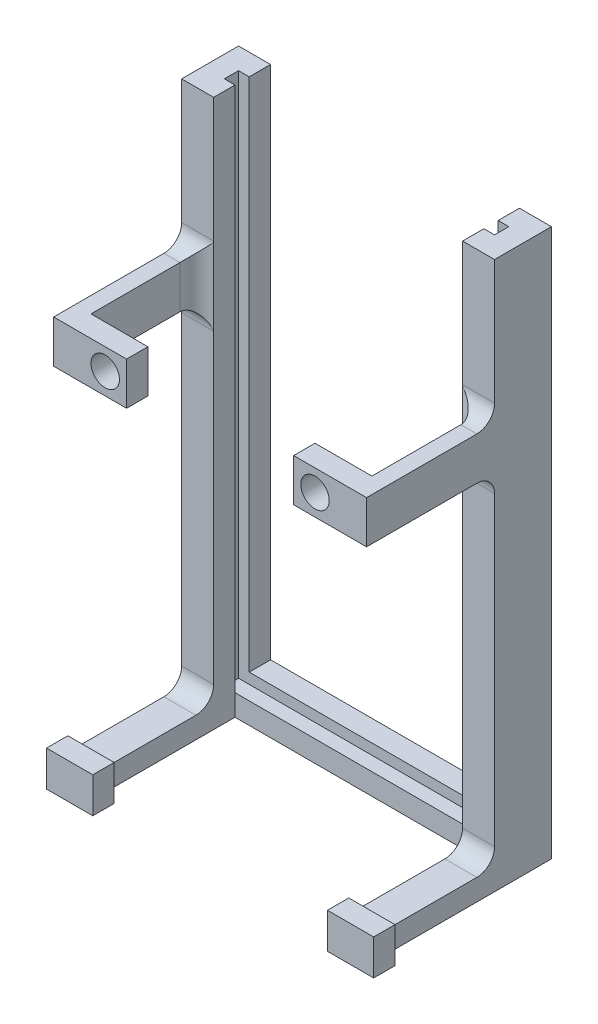
from build123d import *

# Parameters (mm, degrees)
SKETCH2_W           = 44
SKETCH2_H           = 8
BOSS_EXTRUDE2_DEPTH = 4.5
SKETCH3_W           = 38
SKETCH3_H           = 2
CUT_EXTRUDE1_DEPTH  = 1.5
BOSS_EXTRUDE3_DEPTH = 72.5
SKETCH5_W           = 35
SKETCH5_H           = 3
CUT_EXTRUDE2_DEPTH  = 4.8
SKETCH6_W           = 2.25
SKETCH6_H           = 6
BOSS_EXTRUDE5_DEPTH = 18
SKETCH7_W           = 3
SKETCH7_H           = 6
BOSS_EXTRUDE6_DEPTH = 8
SKETCH8_W           = 3
SKETCH8_H           = 6
BOSS_EXTRUDE7_DEPTH = 8
SKETCH9_R           = 2
CUT_EXTRUDE3_DEPTH  = 3
SKETCH10_W          = 4.5
SKETCH10_H          = 3
BOSS_EXTRUDE8_DEPTH = 15
SKETCH11_W          = 6.5
SKETCH11_H          = 5
BOSS_EXTRUDE9_DEPTH = 3
FILLET1_R           = 2.5
FILLET2_START       = 51
FILLET2_DEPTH       = 8.5
FILLET2_START_2     = -19.75
FILLET2_2_DEPTH     = 2.25
FILLET3_START       = -22
FILLET3_DEPTH       = 4.500001455
FILLET3_START_2     = 47
FILLET3_2_DEPTH     = 4
FILLET4_R           = 2.5
FILLET5_R           = 2.5
FILLET6_R           = 2.5
FILLET7_R           = 2.5
FILLET8_R           = 2.5


with BuildPart() as part:
    # Sketch2 → Boss-Extrude2 (new body)
    with BuildSketch(Plane(origin=(0, 0, 0), x_dir=(1, 0, 0), z_dir=(0, 1, 0))):
        Rectangle(SKETCH2_W, SKETCH2_H)
    extrude(amount=BOSS_EXTRUDE2_DEPTH)

    # Sketch3 → Cut-Extrude1 (cut)
    with BuildSketch(Plane(origin=(0, 4.5, 0), x_dir=(1, 0, 0), z_dir=(0, 1, 0))):
        Rectangle(SKETCH3_W, SKETCH3_H)
    extrude(amount=-CUT_EXTRUDE1_DEPTH, mode=Mode.SUBTRACT)

    # Sketch4 → Boss-Extrude3 (add)
    with BuildSketch(Plane(origin=(0, 4.5, 0), x_dir=(1, 0, 0), z_dir=(0, 1, 0))):
        Polygon((-17.5, 1), (-17.5, 4), (-22, 4), (-22, -4), (-17.5, -4), (-17.5, -1), (-19, -1), (-19, 1), align=None)
        Polygon((17.5, 1), (17.5, 4), (22, 4), (22, -4), (17.5, -4), (17.5, -1), (19, -1), (19, 1), align=None)
    extrude(amount=BOSS_EXTRUDE3_DEPTH)

    # Sketch5 → Cut-Extrude2 (cut)
    with BuildSketch(Plane(origin=(0, 4.5, 0), x_dir=(1, 0, 0), z_dir=(0, 1, 0))):
        with Locations((0, -2.5)):
            Rectangle(SKETCH5_W, SKETCH5_H)
    extrude(amount=-CUT_EXTRUDE2_DEPTH, mode=Mode.SUBTRACT)

    # Sketch6 → Boss-Extrude5 (add)
    with BuildSketch(Plane.XY.offset(4)):
        with Locations((-20.875, 54)):
            Rectangle(SKETCH6_W, SKETCH6_H)
        with Locations((20.875, 54)):
            Rectangle(SKETCH6_W, SKETCH6_H)
    extrude(amount=BOSS_EXTRUDE5_DEPTH)

    # Sketch7 → Boss-Extrude6 (add)
    with BuildSketch(Plane.ZY.offset(-19.75)):
        with Locations((20.5, 54)):
            Rectangle(SKETCH7_W, SKETCH7_H)
    extrude(amount=BOSS_EXTRUDE6_DEPTH)

    # Sketch8 → Boss-Extrude7 (add)
    with BuildSketch(Plane(origin=(-19.75, 0, 0), x_dir=(0, 0, -1), z_dir=(1, 0, 0))):
        with Locations((-20.5, 54)):
            Rectangle(SKETCH8_W, SKETCH8_H)
    extrude(amount=BOSS_EXTRUDE7_DEPTH)

    # Sketch9 → Cut-Extrude3 (cut)
    with BuildSketch(Plane(origin=(0, 0, 19), x_dir=(-1, 0, 0), z_dir=(0, 0, -1))):
        with Locations((14.75, 54)):
            Circle(SKETCH9_R)
        with Locations((-14.75, 54)):
            Circle(SKETCH9_R)
    extrude(amount=-CUT_EXTRUDE3_DEPTH, mode=Mode.SUBTRACT)

    # Sketch10 → Boss-Extrude8 (add)
    with BuildSketch(Plane.XY.offset(4)):
        with Locations((19.75, 1.5)):
            Rectangle(SKETCH10_W, SKETCH10_H)
        with Locations((-19.75, 1.5)):
            Rectangle(SKETCH10_W, SKETCH10_H)
    extrude(amount=BOSS_EXTRUDE8_DEPTH)

    # Sketch11 → Boss-Extrude9 (add)
    with BuildSketch(Plane.XY.offset(19)):
        with Locations((-19.75, 1.5)):
            Rectangle(SKETCH11_W, SKETCH11_H)
        with Locations((19.75, 1.5)):
            Rectangle(SKETCH11_W, SKETCH11_H)
    extrude(amount=BOSS_EXTRUDE9_DEPTH)

    # Fillet1
    fillet1_edges = [part.edges().sort_by_distance(p)[0] for p in [
        (-20.875, 57, 4),
    ]]
    fillet(fillet1_edges, radius=FILLET1_R)

    # Fillet2: read off the stored shape, not the designer's step
    # Fillet2 outline → Fillet2 (add)
    with BuildSketch(Plane(origin=(0, 0, 0), x_dir=(1, 0, 0), z_dir=(0, 1, 0)).offset(FILLET2_START)):
        with BuildLine():
            ThreePointArc((-19.75, -6.487468593), (-19.104023888, -4.81038916), (-17.49992366, -3.999992329))
            Line((-17.49992366, -3.999992329), (-19.75, -4))
            Line((-19.75, -4), (-19.75, -6.487468593))
        make_face()
    extrude(amount=FILLET2_DEPTH)

    # Fillet2 2 outline → Fillet2 2 (cut)
    with BuildSketch(Plane.YZ.offset(FILLET2_START_2)):
        with BuildLine():
            Line((57, 8), (57, 6.5))
            ThreePointArc((57, 6.5), (57.732233047, 4.732233047), (59.5, 4))
            Line((59.5, 4), (59.5, 8))
            Line((59.5, 8), (57, 8))
        make_face()
    extrude(amount=FILLET2_2_DEPTH, mode=Mode.SUBTRACT)

    # Fillet3: read off the stored shape, not the designer's step
    # Fillet3 outline → Fillet3 (add)
    with BuildSketch(Plane.YZ.offset(FILLET3_START)):
        with BuildLine():
            Line((51, 4), (51, 6.5))
            ThreePointArc((51, 6.5), (50.267766953, 4.732233047), (48.5, 4))
            Line((48.5, 4), (51, 4))
        make_face()
    extrude(amount=FILLET3_DEPTH)

    # Fillet3 2 outline → Fillet3 2 (cut)
    with BuildSketch(Plane(origin=(0, 0, 0), x_dir=(1, 0, 0), z_dir=(0, 1, 0)).offset(FILLET3_START_2)):
        with BuildLine():
            Line((-17.499998545, -8), (-17.49992366, -3.999992329))
            ThreePointArc((-17.49992366, -3.999992329), (-19.104023888, -4.81038916), (-19.75, -6.487468593))
            Line((-19.75, -6.487468593), (-19.749999999, -8))
            Line((-19.749999999, -8), (-17.499998545, -8))
        make_face()
    extrude(amount=FILLET3_2_DEPTH, mode=Mode.SUBTRACT)

    # Fillet4
    # the kernel refuses this fillet: 2.5 mm, written as the material it adds along each edge
    with BuildSketch(Plane(origin=(19.75, 57, 4), x_dir=(0, 0, 1), z_dir=(0, -1, 0))) as fillet4_piece_1:
        with BuildLine():
            CenterArc((2.487468593, 2.5), FILLET4_R, 185.739170477, 84.260829523)
            Line((0, 2.25), (-0.049749372, 2.245))
            ThreePointArc((-0.049749372, 2.245), (-0.05, 1.125), (-0.05, 0))
            Line((-0.05, 0), (0, -0.05))
            Line((0, -0.05), (2.487468593, -0.05))
            Line((2.487468593, -0.05), (2.487468593, 0))
        make_face()
    extrude(amount=6)

    # Fillet5
    # the kernel refuses this fillet: 2.5 mm, written as the material it adds along each edge
    with BuildSketch(Plane(origin=(22, 57, 4), x_dir=(0, 1, 0), z_dir=(-1, 0, 0))) as fillet5_piece_1_section:
        with BuildLine():
            CenterArc((FILLET5_R, -FILLET5_R), FILLET5_R, 90, 90)
            Line((0, -FILLET5_R), (0, 0))
            Line((0, 0), (FILLET5_R, 0))
        make_face()
    fillet5_piece_1 = extrude(amount=4.5, mode=Mode.PRIVATE)
    fillet5_piece_1 = fillet5_piece_1 - Plane(origin=(17.25, 57, 6.487468593), x_dir=(0, 0, 1), z_dir=(0, 1, 0)) * Cylinder(2.5, 19, mode=Mode.PRIVATE)
    add(fillet5_piece_1)

    # Fillet6
    # the kernel refuses this fillet: 2.5 mm, written as the material it adds along each edge
    with BuildSketch(Plane(origin=(17.5, 51, 4), x_dir=(0, -1, 0), z_dir=(1, 0, 0))) as fillet6_piece_1_section:
        with BuildLine():
            CenterArc((FILLET6_R, -FILLET6_R), FILLET6_R, 90, 90)
            Line((0, -FILLET6_R), (0, 0))
            Line((0, 0), (FILLET6_R, 0))
        make_face()
    fillet6_piece_1 = extrude(amount=4.5, mode=Mode.PRIVATE)
    fillet6_piece_1 = fillet6_piece_1 - Plane(origin=(17.25, 51, 6.487468593), x_dir=(0, 0, 1), z_dir=(0, 1, 0)) * Cylinder(2.5, 19, mode=Mode.PRIVATE)
    add(fillet6_piece_1)

    # Fillet7
    fillet7_edges = [part.edges().sort_by_distance(p)[0] for p in [
        (-19.75, 3, 4),
    ]]
    fillet(fillet7_edges, radius=FILLET7_R)

    # Fillet8
    fillet8_edges = [part.edges().sort_by_distance(p)[0] for p in [
        (19.75, 3, 4),
    ]]
    fillet(fillet8_edges, radius=FILLET8_R)


solid = part.part
